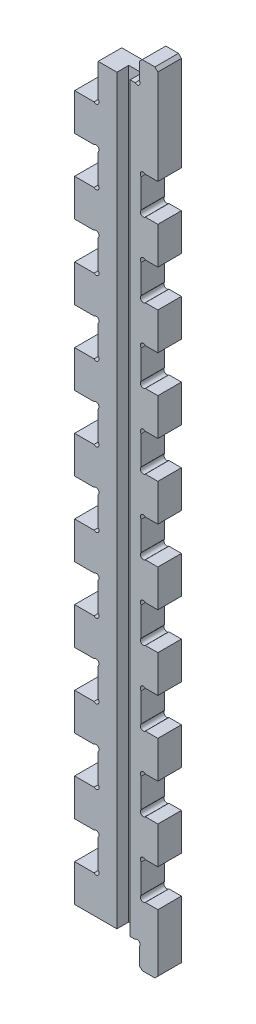
from build123d import *

# Parameters (mm, degrees)
BOSS_EXTRUDE1_DEPTH = 6.35
CHAMFER1_SIZE       = 0.79375
SKETCH16_W          = 3.558466008
SKETCH16_H          = 3.18996611
CUT_EXTRUDE14_DEPTH = 208.663320883


# Read off the part's stored shape, not the designer's step: Boss-Extrude1
with BuildPart() as part:
    # Boss-Extrude1 outline → Boss-Extrude1 (new body)
    with BuildSketch(Plane.XY):
        with BuildLine():
            Line((22.436796564, 150), (19.069200519, 150))
            ThreePointArc((19.069200519, 150), (17.946668504, 150), (17.946668504, 151.122532015))
            Line((17.946668504, 151.122532015), (17.946668504, 158.877467985))
            ThreePointArc((17.946668504, 158.877467985), (17.946668504, 160), (19.069200519, 160))
            Line((19.069200519, 160), (22.436796564, 160))
            Line((22.436796564, 160), (22.436796564, 170))
            Line((22.436796564, 170), (19.069200519, 170))
            ThreePointArc((19.069200519, 170), (17.946668504, 170), (17.946668504, 171.122532015))
            Line((17.946668504, 171.122532015), (17.946668504, 178.877467985))
            ThreePointArc((17.946668504, 178.877467985), (17.946668504, 180), (19.069200519, 180))
            Line((19.069200519, 180), (22.436796564, 180))
            Line((22.436796564, 180), (22.436796564, 206.35))
            Line((22.436796564, 206.35), (17.436796564, 206.35))
            Line((17.436796564, 206.35), (17.436796564, 201.122532015))
            ThreePointArc((17.436796564, 201.122532015), (17.436796564, 200), (16.314264549, 200))
            Line((16.314264549, 200), (6.35, 200))
            Line((6.35, 200), (6.35, 191.122532015))
            ThreePointArc((6.35, 191.122532015), (6.35, 190), (5.227467985, 190))
            Line((5.227467985, 190), (0, 190))
            Line((0, 190), (0, 180))
            Line((0, 180), (5.227467985, 180))
            ThreePointArc((5.227467985, 180), (6.35, 180), (6.35, 178.877467985))
            Line((6.35, 178.877467985), (6.35, 171.122532015))
            ThreePointArc((6.35, 171.122532015), (6.35, 170), (5.227467985, 170))
            Line((5.227467985, 170), (0, 170))
            Line((0, 170), (0, 160))
            Line((0, 160), (5.227467985, 160))
            ThreePointArc((5.227467985, 160), (6.35, 160), (6.35, 158.877467985))
            Line((6.35, 158.877467985), (6.35, 151.122532015))
            ThreePointArc((6.35, 151.122532015), (6.35, 150), (5.227467985, 150))
            Line((5.227467985, 150), (0, 150))
            Line((0, 150), (0, 140))
            Line((0, 140), (5.227467985, 140))
            ThreePointArc((5.227467985, 140), (6.35, 140), (6.35, 138.877467985))
            Line((6.35, 138.877467985), (6.35, 131.122532015))
            ThreePointArc((6.35, 131.122532015), (6.35, 130), (5.227467985, 130))
            Line((5.227467985, 130), (0, 130))
            Line((0, 130), (0, 120))
            Line((0, 120), (5.227467985, 120))
            ThreePointArc((5.227467985, 120), (6.35, 120), (6.35, 118.877467985))
            Line((6.35, 118.877467985), (6.35, 111.122532015))
            ThreePointArc((6.35, 111.122532015), (6.35, 110), (5.227467985, 110))
            Line((5.227467985, 110), (0, 110))
            Line((0, 110), (0, 100))
            Line((0, 100), (5.227467985, 100))
            ThreePointArc((5.227467985, 100), (6.35, 100), (6.35, 98.877467985))
            Line((6.35, 98.877467985), (6.35, 91.122532015))
            ThreePointArc((6.35, 91.122532015), (6.35, 90), (5.227467985, 90))
            Line((5.227467985, 90), (0, 90))
            Line((0, 90), (0, 80))
            Line((0, 80), (5.227467985, 80))
            ThreePointArc((5.227467985, 80), (6.35, 80), (6.35, 78.877467985))
            Line((6.35, 78.877467985), (6.35, 71.122532015))
            ThreePointArc((6.35, 71.122532015), (6.35, 70), (5.227467985, 70))
            Line((5.227467985, 70), (0, 70))
            Line((0, 70), (0, 60))
            Line((0, 60), (5.227467985, 60))
            ThreePointArc((5.227467985, 60), (6.35, 60), (6.35, 58.877467985))
            Line((6.35, 58.877467985), (6.35, 51.122532015))
            ThreePointArc((6.35, 51.122532015), (6.35, 50), (5.227467985, 50))
            Line((5.227467985, 50), (0, 50))
            Line((0, 50), (0, 40))
            Line((0, 40), (5.227467985, 40))
            ThreePointArc((5.227467985, 40), (6.35, 40), (6.35, 38.877467985))
            Line((6.35, 38.877467985), (6.35, 31.122532015))
            ThreePointArc((6.35, 31.122532015), (6.35, 30), (5.227467985, 30))
            Line((5.227467985, 30), (0, 30))
            Line((0, 30), (0, 20))
            Line((0, 20), (5.227467985, 20))
            ThreePointArc((5.227467985, 20), (6.35, 20), (6.35, 18.877467985))
            Line((6.35, 18.877467985), (6.35, 11.122532015))
            ThreePointArc((6.35, 11.122532015), (6.35, 10), (5.227467985, 10))
            Line((5.227467985, 10), (0, 10))
            Line((0, 10), (0, 0))
            Line((0, 0), (16.314264549, 0))
            ThreePointArc((16.314264549, 0), (17.436796564, 0), (17.436796564, -1.122532015))
            Line((17.436796564, -1.122532015), (17.436796564, -6.35))
            Line((17.436796564, -6.35), (22.436796564, -6.35))
            Line((22.436796564, -6.35), (22.436796564, 10))
            Line((22.436796564, 10), (19.069200519, 10))
            ThreePointArc((19.069200519, 10), (17.946668504, 10), (17.946668504, 11.122532015))
            Line((17.946668504, 11.122532015), (17.946668504, 18.877467985))
            ThreePointArc((17.946668504, 18.877467985), (17.946668504, 20), (19.069200519, 20))
            Line((19.069200519, 20), (22.436796564, 20))
            Line((22.436796564, 20), (22.436796564, 30))
            Line((22.436796564, 30), (19.069200519, 30))
            ThreePointArc((19.069200519, 30), (17.946668504, 30), (17.946668504, 31.122532015))
            Line((17.946668504, 31.122532015), (17.946668504, 38.877467985))
            ThreePointArc((17.946668504, 38.877467985), (17.946668504, 40), (19.069200519, 40))
            Line((19.069200519, 40), (22.436796564, 40))
            Line((22.436796564, 40), (22.436796564, 50))
            Line((22.436796564, 50), (19.069200519, 50))
            ThreePointArc((19.069200519, 50), (17.946668504, 50), (17.946668504, 51.122532015))
            Line((17.946668504, 51.122532015), (17.946668504, 58.877467985))
            ThreePointArc((17.946668504, 58.877467985), (17.946668504, 60), (19.069200519, 60))
            Line((19.069200519, 60), (22.436796564, 60))
            Line((22.436796564, 60), (22.436796564, 70))
            Line((22.436796564, 70), (19.069200519, 70))
            ThreePointArc((19.069200519, 70), (17.946668504, 70), (17.946668504, 71.122532015))
            Line((17.946668504, 71.122532015), (17.946668504, 78.877467985))
            ThreePointArc((17.946668504, 78.877467985), (17.946668504, 80), (19.069200519, 80))
            Line((19.069200519, 80), (22.436796564, 80))
            Line((22.436796564, 80), (22.436796564, 90))
            Line((22.436796564, 90), (19.069200519, 90))
            ThreePointArc((19.069200519, 90), (17.946668504, 90), (17.946668504, 91.122532015))
            Line((17.946668504, 91.122532015), (17.946668504, 98.877467985))
            ThreePointArc((17.946668504, 98.877467985), (17.946668504, 100), (19.069200519, 100))
            Line((19.069200519, 100), (22.436796564, 100))
            Line((22.436796564, 100), (22.436796564, 110))
            Line((22.436796564, 110), (19.069200519, 110))
            ThreePointArc((19.069200519, 110), (17.946668504, 110), (17.946668504, 111.122532015))
            Line((17.946668504, 111.122532015), (17.946668504, 118.877467985))
            ThreePointArc((17.946668504, 118.877467985), (17.946668504, 120), (19.069200519, 120))
            Line((19.069200519, 120), (22.436796564, 120))
            Line((22.436796564, 120), (22.436796564, 130))
            Line((22.436796564, 130), (19.069200519, 130))
            ThreePointArc((19.069200519, 130), (17.946668504, 130), (17.946668504, 131.122532015))
            Line((17.946668504, 131.122532015), (17.946668504, 138.877467985))
            ThreePointArc((17.946668504, 138.877467985), (17.946668504, 140), (19.069200519, 140))
            Line((19.069200519, 140), (22.436796564, 140))
            Line((22.436796564, 140), (22.436796564, 150))
        make_face()
    extrude(amount=BOSS_EXTRUDE1_DEPTH)

    # Chamfer1
    chamfer1_edges = [part.edges().sort_by_distance(p)[0] for p in [
        (22.436796564, -6.35, 3.175),
        (17.436796564, -6.35, 3.175),
        (17.436796564, 206.35, 3.175),
        (22.436796564, 206.35, 3.175),
    ]]
    chamfer(chamfer1_edges, length=CHAMFER1_SIZE)

    # Sketch16 → Cut-Extrude14 (cut, through all)
    with BuildSketch(Plane.XZ):
        with Locations((13.182935446, 4.755016945)):
            Rectangle(SKETCH16_W, SKETCH16_H)
    extrude(amount=-CUT_EXTRUDE14_DEPTH, mode=Mode.SUBTRACT)


solid = part.part
